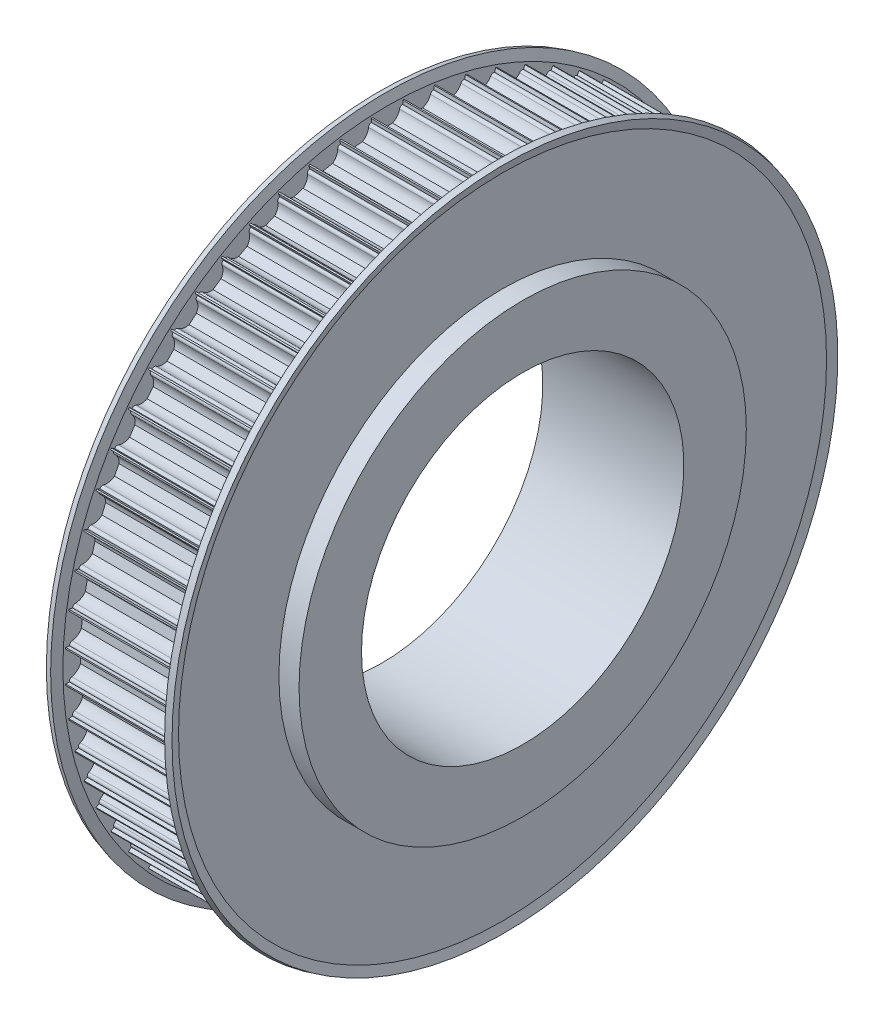
from build123d import *

# Parameters (mm, degrees)
CUT_EXTRUDE1_DEPTH = 119.427192823
CIRPATTERN1_COUNT  = 64


with BuildPart() as part:
    # Sketch1 → Revolve1 (revolve)
    with BuildSketch(Plane.XY, mode=Mode.PRIVATE) as revolve1_sk:
        Polygon((0, 80), (0, 40), (35, 40), (35, 55.5), (30, 55.5), (30, 80), align=None)
    revolve(revolve1_sk.sketch.rotate(Axis((0, 0, 0), (1, 0, 0)), 90), axis=Axis((0, 0, 0), (1, 0, 0)))

    # Sketch2 → Cut-Extrude1 (cut, through all)
    with BuildSketch(Plane.ZY):
        with BuildLine():
            Line((-3.674234614, 79), (-3.75, 79))
            Line((-3.75, 79), (-3.75, 81))
            Line((-3.75, 81), (3.75, 81))
            Line((3.75, 81), (3.75, 79))
            Line((3.75, 79), (3.674234614, 79))
            ThreePointArc((3.674234614, 79), (3.199892965, 78.830947502), (2.939387691, 78.4))
            ThreePointArc((2.939387691, 78.4), (2.331759211, 77.112435701), (1.198957881, 76.25))
            Line((1.198957881, 76.25), (-1.198957881, 76.25))
            ThreePointArc((-1.198957881, 76.25), (-2.331759211, 77.112435701), (-2.939387691, 78.4))
            ThreePointArc((-2.939387691, 78.4), (-3.199892965, 78.830947502), (-3.674234614, 79))
        make_face()
    cut_extrude1 = extrude(amount=-CUT_EXTRUDE1_DEPTH, mode=Mode.SUBTRACT)

    # CirPattern1: Cut-Extrude1 ×64 about axis
    cirpattern1_axis = Axis((0, 0, 0), (1, 0, 0))
    for i in range(1, CIRPATTERN1_COUNT):
        add(cut_extrude1.rotate(cirpattern1_axis, i * 360 / CIRPATTERN1_COUNT), mode=Mode.SUBTRACT)

    # Sketch3 → Revolve2 (revolve)
    with BuildSketch(Plane.XY, mode=Mode.PRIVATE) as revolve2_sk:
        Polygon((30, 55.5), (28.5, 55.5), (28.5, 80.61), (29.143078062, 83.01), (30.591966801, 82.621771432), (30, 80.412521254), align=None)
        Polygon((0, 55.5), (1.5, 55.5), (1.5, 80.61), (0.856921938, 83.01), (-0.591966801, 82.621771432), (0, 80.412521254), align=None)
    revolve(revolve2_sk.sketch.rotate(Axis((0, 0, 0), (1, 0, 0)), 90), axis=Axis((0, 0, 0), (1, 0, 0)))


solid = part.part
